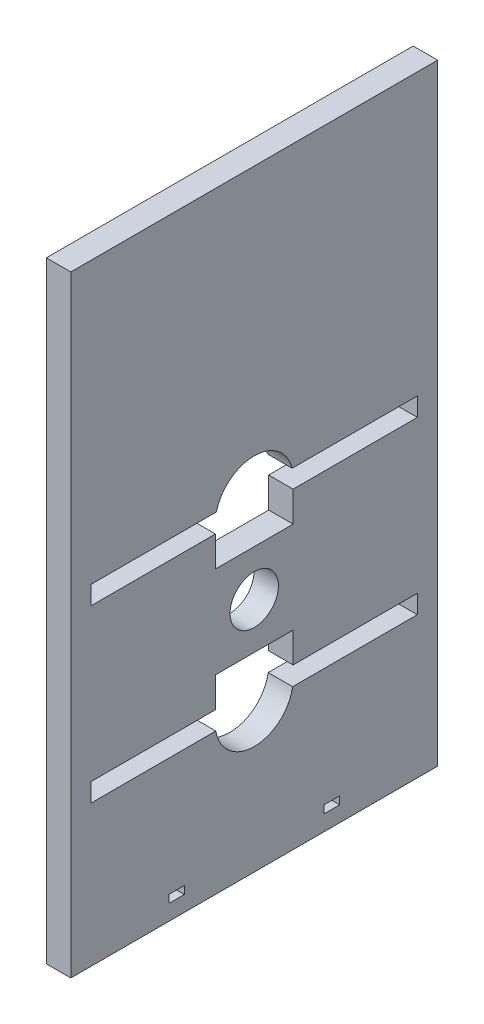
from build123d import *

# Parameters (mm, degrees)
SKETCH1_W           = 30
SKETCH1_H           = 50
BOSS_EXTRUDE1_DEPTH = 2
SKETCH2_R           = 1.98
SKETCH2_W           = 1.27
SKETCH2_H           = 0.64
CUT_EXTRUDE1_DEPTH  = 2


with BuildPart() as part:
    # Sketch1 → Boss-Extrude1 (new body)
    with BuildSketch(Plane(origin=(0, 0, 0), x_dir=(0, 0, -1), z_dir=(1, 0, 0))):
        with Locations((-15, 8.104395604)):
            Rectangle(SKETCH1_W, SKETCH1_H)
    extrude(amount=BOSS_EXTRUDE1_DEPTH)

    # Sketch2 → Cut-Extrude1 (cut)
    with BuildSketch(Plane(origin=(2, 0, 0), x_dir=(0, 0, -1), z_dir=(1, 0, 0))):
        with Locations((-15, 2.404395604)):
            Circle(SKETCH2_R)
        with Locations((-21.35, -15.305604396)):
            Rectangle(SKETCH2_W, SKETCH2_H)
        with Locations((-8.65, -15.305604396)):
            Rectangle(SKETCH2_W, SKETCH2_H)
        with BuildLine():
            Line((-11.902152854, 10.154395604), (-1.66, 10.154395604))
            Line((-1.66, 10.154395604), (-1.66, 8.634395604))
            Line((-1.66, 8.634395604), (-11.82, 8.634395604))
            Line((-11.82, 8.634395604), (-11.82, 6.154395604))
            Line((-11.82, 6.154395604), (-18.17, 6.154395604))
            Line((-18.17, 6.154395604), (-18.17, 8.634395604))
            Line((-18.17, 8.634395604), (-28.33, 8.634395604))
            Line((-28.33, 8.634395604), (-28.33, 10.154395604))
            Line((-28.33, 10.154395604), (-18.087847146, 10.154395604))
            ThreePointArc((-18.087847146, 10.154395604), (-14.995, 12.579250934), (-11.902152854, 10.154395604))
        make_face()
        with BuildLine():
            Line((-11.861162636, -5.335604396), (-1.665, -5.335604396))
            Line((-1.665, -5.335604396), (-1.665, -3.815604396))
            Line((-1.665, -3.815604396), (-11.825, -3.815604396))
            Line((-11.825, -3.815604396), (-11.825, -1.345604396))
            Line((-11.825, -1.345604396), (-18.175, -1.345604396))
            Line((-18.175, -1.345604396), (-18.175, -3.815604396))
            Line((-18.175, -3.815604396), (-28.335, -3.815604396))
            Line((-28.335, -3.815604396), (-28.335, -5.335604396))
            Line((-28.335, -5.335604396), (-18.138837364, -5.335604396))
            ThreePointArc((-18.138837364, -5.335604396), (-15, -8.005604396), (-11.861162636, -5.335604396))
        make_face()
    extrude(amount=-CUT_EXTRUDE1_DEPTH, mode=Mode.SUBTRACT)


solid = part.part
